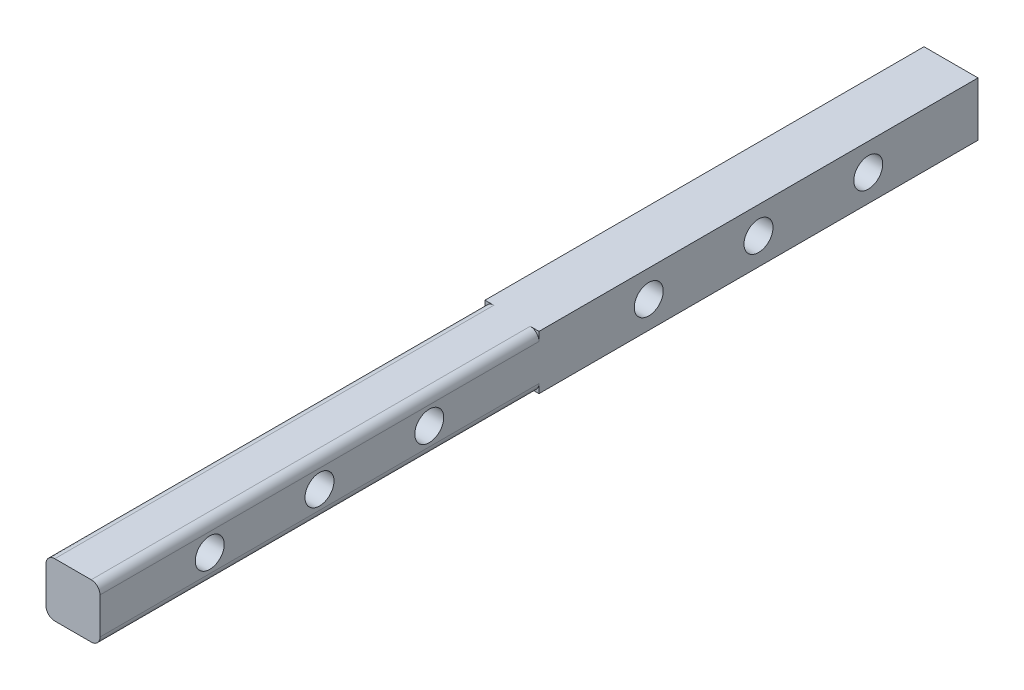
from build123d import *

# Parameters (mm, degrees)
SKETCH_1_W          = 6.15
SKETCH_1_H          = 6.15
EXTRUDE_1_DEPTH     = 50
FILLET_1_R          = 1
SKETCH_1_2_W        = 6.15
SKETCH_1_2_H        = 6.15
EXTRUDE_2_DEPTH     = 50
SKETCH_2_R          = 1.65
CUT_EXTRUDE_1_DEPTH = 51.470566918


with BuildPart() as part:
    # 草图1 → 凸台-拉伸1 (new body)
    with BuildSketch(Plane.XY):
        Rectangle(SKETCH_1_W, SKETCH_1_H)
    extrude(amount=EXTRUDE_1_DEPTH)

    # 圆角1
    fillet_1_edges = [part.edges().sort_by_distance(p)[0] for p in [
        (3.075, -3.075, 25),
        (-3.075, -3.075, 25),
        (-3.075, 3.075, 25),
        (3.075, 3.075, 25),
    ]]
    fillet(fillet_1_edges, radius=FILLET_1_R)

    # 草图1<2> → 凸台-拉伸2 (add)
    with BuildSketch(Plane.XY):
        Rectangle(SKETCH_1_2_W, SKETCH_1_2_H)
    extrude(amount=-EXTRUDE_2_DEPTH)

    # 草图2 → 切除-拉伸1 (cut, through all)
    with BuildSketch(Plane(origin=(3.075, 0, 0), x_dir=(0, 0, -1), z_dir=(1, 0, 0))):
        with Locations((-37.5, 0)):
            Circle(SKETCH_2_R)
        with Locations((-25, 0)):
            Circle(SKETCH_2_R)
        with Locations((-12.5, 0)):
            Circle(SKETCH_2_R)
        with Locations((12.5, 0)):
            Circle(SKETCH_2_R)
        with Locations((25, 0)):
            Circle(SKETCH_2_R)
        with Locations((37.5, 0)):
            Circle(SKETCH_2_R)
    extrude(amount=-CUT_EXTRUDE_1_DEPTH, mode=Mode.SUBTRACT)


solid = part.part
